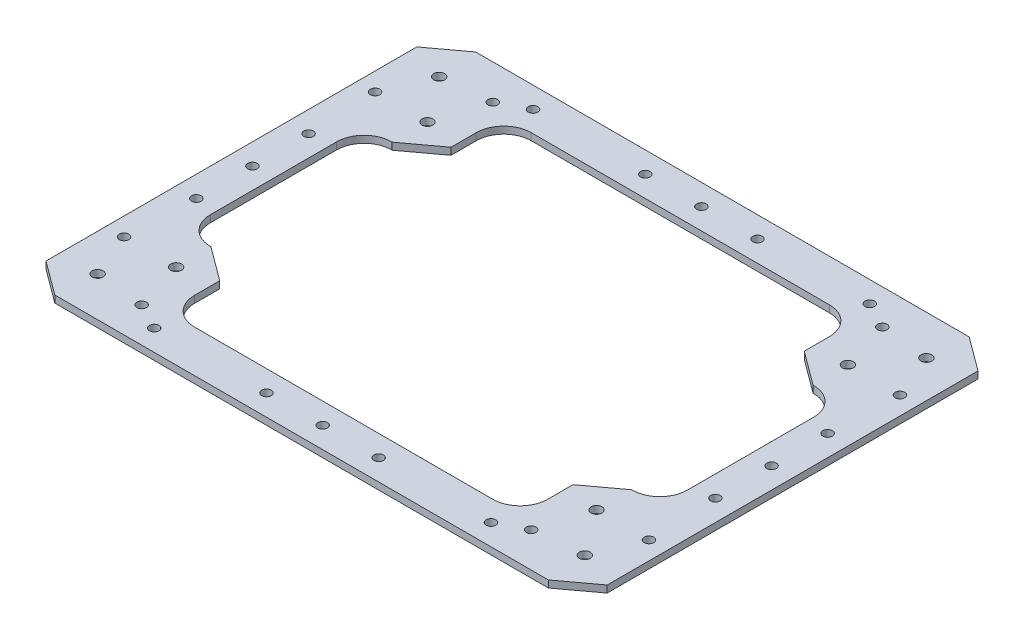
from build123d import *

# Parameters (mm, degrees)
BOSS_EXTRUDE1_DEPTH = 3.175
SKETCH2_R           = 2.4638
SKETCH2_R_2         = 2.159
CUT_EXTRUDE1_DEPTH  = 159.781746826
SKETCH3_R           = 2.159
CUT_EXTRUDE2_DEPTH  = 159.781746826


with BuildPart() as part:
    # Sketch1 → Boss-Extrude1 (new body)
    with BuildSketch(Plane(origin=(0, 0, 0), x_dir=(1, 0, 0), z_dir=(0, 1, 0))):
        Polygon((-111.686526805, 95.25), (-127, 83.918625912), (-127, -83.918625912), (-111.686526805, -95.25), (111.686526805, -95.25), (127, -83.918625912), (127, 83.918625912), (111.686526805, 95.25), align=None)
        with BuildLine():
            Line((-107.95, -28.564963508), (-107.95, 28.564963508))
            ThreePointArc((-107.95, 28.564963508), (-104.304650999, 37.365614506), (-95.504, 41.010963508))
            Line((-95.504, 41.010963508), (-95.25, 41.010963508))
            Line((-95.25, 41.010963508), (-79.936526805, 52.342337595))
            Line((-79.936526805, 52.342337595), (-79.936526805, 63.754))
            ThreePointArc((-79.936526805, 63.754), (-76.291177804, 72.554650999), (-67.490526805, 76.2))
            Line((-67.490526805, 76.2), (67.490526805, 76.2))
            ThreePointArc((67.490526805, 76.2), (76.291177804, 72.554650999), (79.936526805, 63.754))
            Line((79.936526805, 63.754), (79.936526805, 52.342337595))
            Line((79.936526805, 52.342337595), (95.25, 41.010963508))
            Line((95.25, 41.010963508), (95.504, 41.010963508))
            ThreePointArc((95.504, 41.010963508), (104.304650999, 37.365614506), (107.95, 28.564963508))
            Line((107.95, 28.564963508), (107.95, -28.564963508))
            ThreePointArc((107.95, -28.564963508), (104.304650999, -37.365614506), (95.504, -41.010963508))
            Line((95.504, -41.010963508), (95.25, -41.010963508))
            Line((95.25, -41.010963508), (79.936526805, -52.342337595))
            Line((79.936526805, -52.342337595), (79.936526805, -63.754))
            ThreePointArc((79.936526805, -63.754), (76.291177804, -72.554650999), (67.490526805, -76.2))
            Line((67.490526805, -76.2), (-67.490526805, -76.2))
            ThreePointArc((-67.490526805, -76.2), (-76.291177804, -72.554650999), (-79.936526805, -63.754))
            Line((-79.936526805, -63.754), (-79.936526805, -52.342337595))
            Line((-79.936526805, -52.342337595), (-95.25, -41.010963508))
            Line((-95.25, -41.010963508), (-95.504, -41.010963508))
            ThreePointArc((-95.504, -41.010963508), (-104.304650999, -37.365614506), (-107.95, -28.564963508))
        make_face(mode=Mode.SUBTRACT)
    extrude(amount=BOSS_EXTRUDE1_DEPTH)

    # Sketch2 → Cut-Extrude1 (cut, through all)
    with BuildSketch(Plane(origin=(0, 3.175, 0), x_dir=(1, 0, 0), z_dir=(0, 1, 0))):
        with Locations((-95.147512794, 56.885632681)):
            Circle(SKETCH2_R)
        with Locations((-110.256011578, 77.303596941)):
            Circle(SKETCH2_R)
        with Locations((110.256011578, 77.303596941)):
            Circle(SKETCH2_R)
        with Locations((95.147512794, 56.885632681)):
            Circle(SKETCH2_R)
        with Locations((110.256011578, -77.303596941)):
            Circle(SKETCH2_R)
        with Locations((95.147512794, -56.885632681)):
            Circle(SKETCH2_R)
        with Locations((-110.256011578, -77.303596941)):
            Circle(SKETCH2_R)
        with Locations((-95.147512794, -56.885632681)):
            Circle(SKETCH2_R)
        with Locations((-88.154790208, 79.461855841)):
            Circle(SKETCH2_R_2)
        with Locations((-118.781736597, 56.799107666)):
            Circle(SKETCH2_R_2)
        with Locations((118.781736597, 56.799107666)):
            Circle(SKETCH2_R_2)
        with Locations((88.154790208, 79.461855841)):
            Circle(SKETCH2_R_2)
        with Locations((118.781736597, -56.799107666)):
            Circle(SKETCH2_R_2)
        with Locations((88.154790208, -79.461855841)):
            Circle(SKETCH2_R_2)
        with Locations((-88.154790208, -79.461855841)):
            Circle(SKETCH2_R_2)
        with Locations((-118.781736597, -56.799107666)):
            Circle(SKETCH2_R_2)
    extrude(amount=-CUT_EXTRUDE1_DEPTH, mode=Mode.SUBTRACT)

    # Sketch3 → Cut-Extrude2 (cut, through all)
    with BuildSketch(Plane(origin=(0, 3.175, 0), x_dir=(1, 0, 0), z_dir=(0, 1, 0))):
        with Locations((-76.2, 85.725)):
            Circle(SKETCH3_R)
        with Locations((-25.4, 85.725)):
            Circle(SKETCH3_R)
        with Locations((25.4, 85.725)):
            Circle(SKETCH3_R)
        with Locations((76.2, 85.725)):
            Circle(SKETCH3_R)
        with Locations((76.2, -85.725)):
            Circle(SKETCH3_R)
        with Locations((25.4, -85.725)):
            Circle(SKETCH3_R)
        with Locations((-25.4, -85.725)):
            Circle(SKETCH3_R)
        with Locations((-76.2, -85.725)):
            Circle(SKETCH3_R)
        with Locations((-117.475, -25.4)):
            Circle(SKETCH3_R)
        with Locations((-117.475, 25.4)):
            Circle(SKETCH3_R)
        with Locations((117.475, 25.4)):
            Circle(SKETCH3_R)
        with Locations((117.475, -25.4)):
            Circle(SKETCH3_R)
        with Locations((0, 85.725)):
            Circle(SKETCH3_R)
        with Locations((0, -85.725)):
            Circle(SKETCH3_R)
        with Locations((-117.475, 0)):
            Circle(SKETCH3_R)
        with Locations((117.475, 0)):
            Circle(SKETCH3_R)
    extrude(amount=-CUT_EXTRUDE2_DEPTH, mode=Mode.SUBTRACT)


solid = part.part
